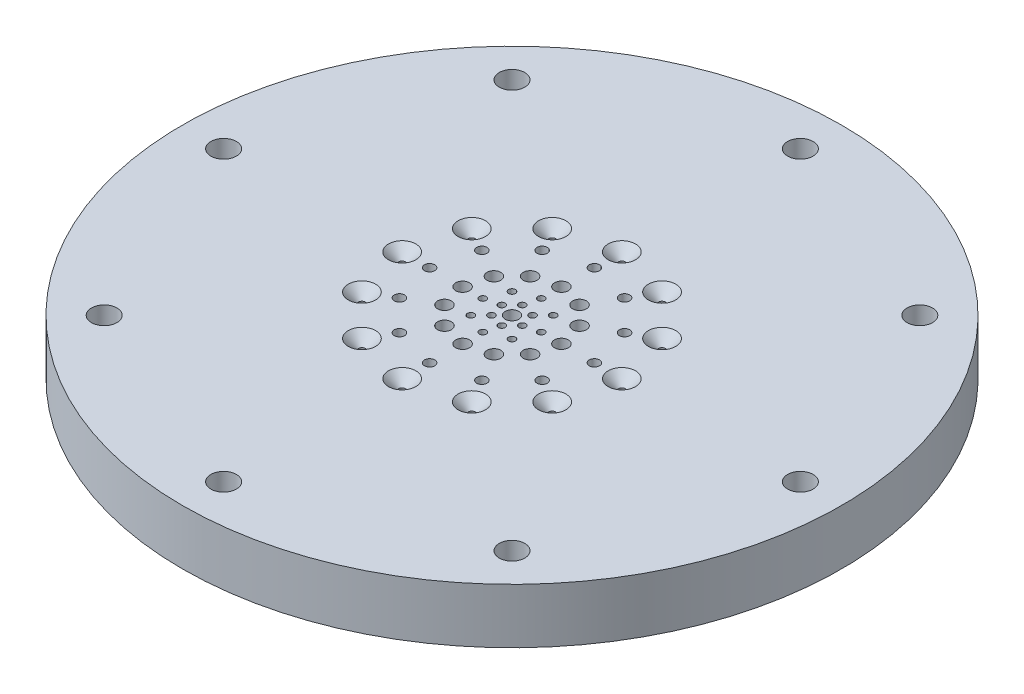
from build123d import *

# Parameters (mm, degrees)
SKETCH1_R                                      = 38.1
BOSS_EXTRUDE1_DEPTH                            = 6.35
CBORE_FOR_4_BUTTON_HEAD_CAP_SCREW1_D           = 2.9464
CBORE_FOR_4_BUTTON_HEAD_CAP_SCREW1_CBORE_D     = 4.826
CBORE_FOR_4_BUTTON_HEAD_CAP_SCREW1_CBORE_DEPTH = 2.8448
CIRPATTERN1_COUNT                              = 8
SKETCH7_R                                      = 0.3937
SKETCH7_R_2                                    = 0.5969
SKETCH7_R_3                                    = 0.8001
SKETCH7_R_4                                    = 0.79375
CUT_EXTRUDE1_DEPTH                             = 55.254423783
CIRPATTERN3_COUNT                              = 12
CUT_EXTRUDE3_REACH                             = 56.254
SKETCH8_R                                      = 0.396875
CUT_EXTRUDE4_REACH                             = 56.254
SKETCH9_R                                      = 0.396875
CHAMFER1_SIZE                                  = 1.190625


with BuildPart() as part:
    # Sketch1 → Boss-Extrude1 (new body)
    with BuildSketch(Plane(origin=(0, 0, 0), x_dir=(1, 0, 0), z_dir=(0, 1, 0))):
        Circle(SKETCH1_R)
    extrude(amount=BOSS_EXTRUDE1_DEPTH)

    # CBORE for #4 Button Head Cap Screw1 (through all)
    with Locations(Plane(origin=(0, 0, 0), x_dir=(-1, 0, 0), z_dir=(0, -1, 0))):
        with Locations((0, -33.3375)):
            cbore_for_4_button_head_cap_screw1 = CounterBoreHole(CBORE_FOR_4_BUTTON_HEAD_CAP_SCREW1_D / 2, CBORE_FOR_4_BUTTON_HEAD_CAP_SCREW1_CBORE_D / 2, CBORE_FOR_4_BUTTON_HEAD_CAP_SCREW1_CBORE_DEPTH)

    # CirPattern1: CBORE for #4 Button Head Cap Screw1 ×8 about axis
    cirpattern1_axis = Axis((0, 0, 0), (0, 1, 0))
    for i in range(1, CIRPATTERN1_COUNT):
        add(cbore_for_4_button_head_cap_screw1.rotate(cirpattern1_axis, i * 360 / CIRPATTERN1_COUNT), mode=Mode.SUBTRACT)

    # Sketch7 → Cut-Extrude1 (cut, through all)
    with BuildSketch(Plane.XZ):
        with Locations((0, 12.7)):
            Circle(SKETCH7_R)
        with Locations((0, 9.525)):
            Circle(SKETCH7_R_2)
        with Locations((0, 5.715)):
            Circle(SKETCH7_R_3)
        Circle(SKETCH7_R_4)
    cut_extrude1 = extrude(amount=-CUT_EXTRUDE1_DEPTH, mode=Mode.SUBTRACT)

    # CirPattern3: Cut-Extrude1 ×12 about axis
    cirpattern3_axis = Axis((0, 0, 0), (0, 1, 0))
    for i in range(1, CIRPATTERN3_COUNT):
        add(cut_extrude1.rotate(cirpattern3_axis, i * 360 / CIRPATTERN3_COUNT), mode=Mode.SUBTRACT)

    # Sketch8 → Cut-Extrude3 (cut, up to next)
    with BuildSketch(Plane(origin=(0, 6.35, 0), x_dir=(1, 0, 0), z_dir=(0, 1, 0)), mode=Mode.PRIVATE) as cut_extrude3_sk1:
        with Locations((3.368817958, 0)):
            Circle(SKETCH8_R)
    cut_extrude3_tool1 = extrude(cut_extrude3_sk1.sketch, amount=-CUT_EXTRUDE3_REACH, mode=Mode.PRIVATE) & part.part
    # Sketch8 → Cut-Extrude3 (cut, up to next)
    with BuildSketch(Plane(origin=(0, 6.35, 0), x_dir=(1, 0, 0), z_dir=(0, 1, 0)), mode=Mode.PRIVATE) as cut_extrude3_sk2:
        with Locations((2.382114023, -2.382114023)):
            Circle(SKETCH8_R)
    cut_extrude3_tool2 = extrude(cut_extrude3_sk2.sketch, amount=-CUT_EXTRUDE3_REACH, mode=Mode.PRIVATE) & part.part
    # Sketch8 → Cut-Extrude3 (cut, up to next)
    with BuildSketch(Plane(origin=(0, 6.35, 0), x_dir=(1, 0, 0), z_dir=(0, 1, 0)), mode=Mode.PRIVATE) as cut_extrude3_sk3:
        with Locations((0, -3.368817958)):
            Circle(SKETCH8_R)
    cut_extrude3_tool3 = extrude(cut_extrude3_sk3.sketch, amount=-CUT_EXTRUDE3_REACH, mode=Mode.PRIVATE) & part.part
    # Sketch8 → Cut-Extrude3 (cut, up to next)
    with BuildSketch(Plane(origin=(0, 6.35, 0), x_dir=(1, 0, 0), z_dir=(0, 1, 0)), mode=Mode.PRIVATE) as cut_extrude3_sk4:
        with Locations((-2.382114023, -2.382114023)):
            Circle(SKETCH8_R)
    cut_extrude3_tool4 = extrude(cut_extrude3_sk4.sketch, amount=-CUT_EXTRUDE3_REACH, mode=Mode.PRIVATE) & part.part
    # Sketch8 → Cut-Extrude3 (cut, up to next)
    with BuildSketch(Plane(origin=(0, 6.35, 0), x_dir=(1, 0, 0), z_dir=(0, 1, 0)), mode=Mode.PRIVATE) as cut_extrude3_sk5:
        with Locations((-3.368817958, 0)):
            Circle(SKETCH8_R)
    cut_extrude3_tool5 = extrude(cut_extrude3_sk5.sketch, amount=-CUT_EXTRUDE3_REACH, mode=Mode.PRIVATE) & part.part
    # Sketch8 → Cut-Extrude3 (cut, up to next)
    with BuildSketch(Plane(origin=(0, 6.35, 0), x_dir=(1, 0, 0), z_dir=(0, 1, 0)), mode=Mode.PRIVATE) as cut_extrude3_sk6:
        with Locations((-2.382114023, 2.382114023)):
            Circle(SKETCH8_R)
    cut_extrude3_tool6 = extrude(cut_extrude3_sk6.sketch, amount=-CUT_EXTRUDE3_REACH, mode=Mode.PRIVATE) & part.part
    # Sketch8 → Cut-Extrude3 (cut, up to next)
    with BuildSketch(Plane(origin=(0, 6.35, 0), x_dir=(1, 0, 0), z_dir=(0, 1, 0)), mode=Mode.PRIVATE) as cut_extrude3_sk7:
        with Locations((0, 3.368817958)):
            Circle(SKETCH8_R)
    cut_extrude3_tool7 = extrude(cut_extrude3_sk7.sketch, amount=-CUT_EXTRUDE3_REACH, mode=Mode.PRIVATE) & part.part
    # Sketch8 → Cut-Extrude3 (cut, up to next)
    with BuildSketch(Plane(origin=(0, 6.35, 0), x_dir=(1, 0, 0), z_dir=(0, 1, 0)), mode=Mode.PRIVATE) as cut_extrude3_sk8:
        with Locations((2.382114023, 2.382114023)):
            Circle(SKETCH8_R)
    cut_extrude3_tool8 = extrude(cut_extrude3_sk8.sketch, amount=-CUT_EXTRUDE3_REACH, mode=Mode.PRIVATE) & part.part
    add(cut_extrude3_tool1.solids().sort_by_distance((3.368818, 6.35, 0))[0], mode=Mode.SUBTRACT)
    add(cut_extrude3_tool2.solids().sort_by_distance((2.382114, 6.35, 2.382114))[0], mode=Mode.SUBTRACT)
    add(cut_extrude3_tool3.solids().sort_by_distance((0, 6.35, 3.368818))[0], mode=Mode.SUBTRACT)
    add(cut_extrude3_tool4.solids().sort_by_distance((-2.382114, 6.35, 2.382114))[0], mode=Mode.SUBTRACT)
    add(cut_extrude3_tool5.solids().sort_by_distance((-3.368818, 6.35, 0))[0], mode=Mode.SUBTRACT)
    add(cut_extrude3_tool6.solids().sort_by_distance((-2.382114, 6.35, -2.382114))[0], mode=Mode.SUBTRACT)
    add(cut_extrude3_tool7.solids().sort_by_distance((0, 6.35, -3.368818))[0], mode=Mode.SUBTRACT)
    add(cut_extrude3_tool8.solids().sort_by_distance((2.382114, 6.35, -2.382114))[0], mode=Mode.SUBTRACT)

    # Sketch9 → Cut-Extrude4 (cut, up to next)
    with BuildSketch(Plane(origin=(0, 6.35, 0), x_dir=(1, 0, 0), z_dir=(0, 1, 0)), mode=Mode.PRIVATE) as cut_extrude4_sk1:
        with Locations((1.187739958, 1.187739958)):
            Circle(SKETCH9_R)
    cut_extrude4_tool1 = extrude(cut_extrude4_sk1.sketch, amount=-CUT_EXTRUDE4_REACH, mode=Mode.PRIVATE) & part.part
    # Sketch9 → Cut-Extrude4 (cut, up to next)
    with BuildSketch(Plane(origin=(0, 6.35, 0), x_dir=(1, 0, 0), z_dir=(0, 1, 0)), mode=Mode.PRIVATE) as cut_extrude4_sk2:
        with Locations((1.622482956, -0.434742998)):
            Circle(SKETCH9_R)
    cut_extrude4_tool2 = extrude(cut_extrude4_sk2.sketch, amount=-CUT_EXTRUDE4_REACH, mode=Mode.PRIVATE) & part.part
    # Sketch9 → Cut-Extrude4 (cut, up to next)
    with BuildSketch(Plane(origin=(0, 6.35, 0), x_dir=(1, 0, 0), z_dir=(0, 1, 0)), mode=Mode.PRIVATE) as cut_extrude4_sk3:
        with Locations((0.434742998, -1.622482956)):
            Circle(SKETCH9_R)
    cut_extrude4_tool3 = extrude(cut_extrude4_sk3.sketch, amount=-CUT_EXTRUDE4_REACH, mode=Mode.PRIVATE) & part.part
    # Sketch9 → Cut-Extrude4 (cut, up to next)
    with BuildSketch(Plane(origin=(0, 6.35, 0), x_dir=(1, 0, 0), z_dir=(0, 1, 0)), mode=Mode.PRIVATE) as cut_extrude4_sk4:
        with Locations((-1.187739958, -1.187739958)):
            Circle(SKETCH9_R)
    cut_extrude4_tool4 = extrude(cut_extrude4_sk4.sketch, amount=-CUT_EXTRUDE4_REACH, mode=Mode.PRIVATE) & part.part
    # Sketch9 → Cut-Extrude4 (cut, up to next)
    with BuildSketch(Plane(origin=(0, 6.35, 0), x_dir=(1, 0, 0), z_dir=(0, 1, 0)), mode=Mode.PRIVATE) as cut_extrude4_sk5:
        with Locations((-1.622482956, 0.434742998)):
            Circle(SKETCH9_R)
    cut_extrude4_tool5 = extrude(cut_extrude4_sk5.sketch, amount=-CUT_EXTRUDE4_REACH, mode=Mode.PRIVATE) & part.part
    # Sketch9 → Cut-Extrude4 (cut, up to next)
    with BuildSketch(Plane(origin=(0, 6.35, 0), x_dir=(1, 0, 0), z_dir=(0, 1, 0)), mode=Mode.PRIVATE) as cut_extrude4_sk6:
        with Locations((-0.434742998, 1.622482956)):
            Circle(SKETCH9_R)
    cut_extrude4_tool6 = extrude(cut_extrude4_sk6.sketch, amount=-CUT_EXTRUDE4_REACH, mode=Mode.PRIVATE) & part.part
    add(cut_extrude4_tool1.solids().sort_by_distance((1.18774, 6.35, -1.18774))[0], mode=Mode.SUBTRACT)
    add(cut_extrude4_tool2.solids().sort_by_distance((1.622483, 6.35, 0.434743))[0], mode=Mode.SUBTRACT)
    add(cut_extrude4_tool3.solids().sort_by_distance((0.434743, 6.35, 1.622483))[0], mode=Mode.SUBTRACT)
    add(cut_extrude4_tool4.solids().sort_by_distance((-1.18774, 6.35, 1.18774))[0], mode=Mode.SUBTRACT)
    add(cut_extrude4_tool5.solids().sort_by_distance((-1.622483, 6.35, -0.434743))[0], mode=Mode.SUBTRACT)
    add(cut_extrude4_tool6.solids().sort_by_distance((-0.434743, 6.35, -1.622483))[0], mode=Mode.SUBTRACT)

    # Chamfer1
    chamfer1_edges = [part.edges().sort_by_distance(p)[0] for p in [
        (6.690954201, 6.35, -10.801672628),
        (11.195372628, 6.35, -6.009045799),
        (12.7, 6.35, 0.3937),
        (10.801672628, 6.35, 6.690954201),
        (6.009045799, 6.35, 11.195372628),
        (-0.3937, 6.35, 12.7),
        (-6.690954201, 6.35, 10.801672628),
        (-11.195372628, 6.35, 6.009045799),
        (-12.7, 6.35, -0.3937),
        (-10.801672628, 6.35, -6.690954201),
        (-6.009045799, 6.35, -11.195372628),
        (0.3937, 6.35, -12.7),
    ]]
    chamfer(chamfer1_edges, length=CHAMFER1_SIZE)


solid = part.part
